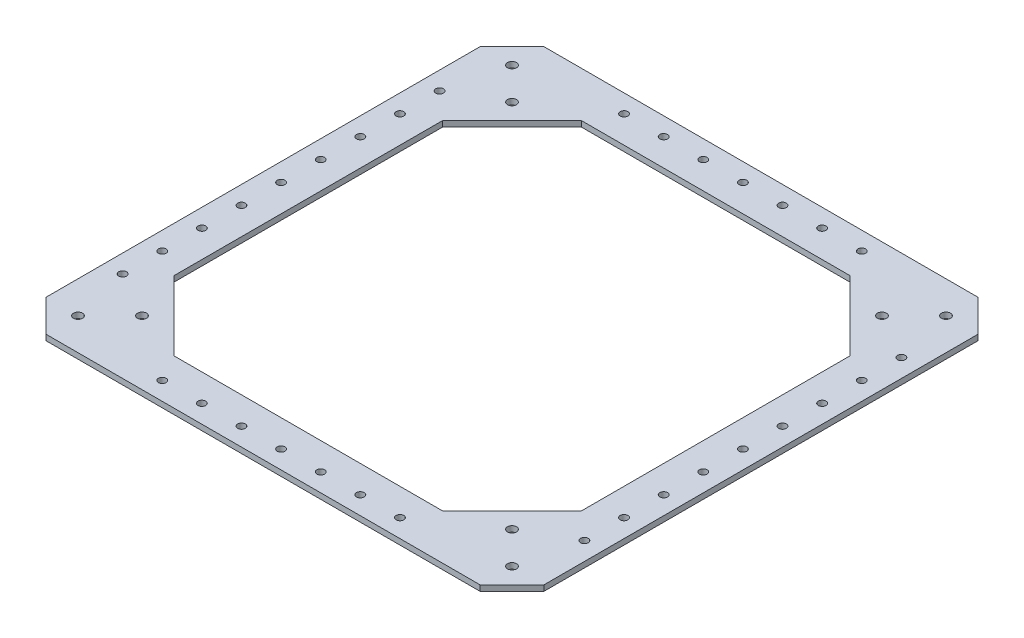
from build123d import *

# Parameters (mm, degrees)
BOSS_EXTRUDE1_DEPTH = 3.175
CUT_EXTRUDE4_DEPTH  = 235.179100055
SKETCH5_R           = 2.54
CUT_EXTRUDE3_DEPTH  = 235.179100055
SKETCH4_R           = 2.159
CUT_EXTRUDE2_DEPTH  = 235.179100055


with BuildPart() as part:
    # Sketch1 → Boss-Extrude1 (new body)
    with BuildSketch(Plane(origin=(0, 0, 0), x_dir=(1, 0, 0), z_dir=(0, 1, 0))):
        Polygon((-139.7, 73.520142619), (-121.739487758, 91.480654861), (121.739487758, 91.480654861), (139.7, 73.520142619), (139.7, -169.958832897), (121.739487758, -187.919345139), (-121.739487758, -187.919345139), (-139.7, -169.958832897), align=None)
    extrude(amount=BOSS_EXTRUDE1_DEPTH)

    # Sketch2 → Cut-Extrude4 (cut, through all)
    with BuildSketch(Plane(origin=(0, 3.175, 0), x_dir=(1, 0, 0), z_dir=(0, 1, 0))):
        Polygon((-103.778975516, 37.599118134), (-114.3, 27.07809365), (-114.3, -123.516783928), (-103.778975516, -134.037808413), (-85.818463274, -151.998320655), (-75.297438789, -162.519345139), (75.297438789, -162.519345139), (85.818463274, -151.998320655), (103.778975516, -134.037808413), (114.3, -123.516783928), (114.3, 27.07809365), (103.778975516, 37.599118134), (85.818463274, 55.559630377), (75.297438789, 66.080654861), (-75.297438789, 66.080654861), (-85.818463274, 55.559630377), align=None)
    extrude(amount=-CUT_EXTRUDE4_DEPTH, mode=Mode.SUBTRACT)

    # Sketch5 → Cut-Extrude3 (cut, through all)
    with BuildSketch(Plane(origin=(0, 3.175, 0), x_dir=(1, 0, 0), z_dir=(0, 1, 0))):
        with Locations((-121.739487758, 73.520142619)):
            Circle(SKETCH5_R)
        with Locations((-103.778975516, 55.559630377)):
            Circle(SKETCH5_R)
        with Locations((103.778975516, 55.559630377)):
            Circle(SKETCH5_R)
        with Locations((121.739487758, 73.520142619)):
            Circle(SKETCH5_R)
        with Locations((121.739487758, -169.958832897)):
            Circle(SKETCH5_R)
        with Locations((103.778975516, -151.998320655)):
            Circle(SKETCH5_R)
        with Locations((-103.778975516, -151.998320655)):
            Circle(SKETCH5_R)
        with Locations((-121.739487758, -169.958832897)):
            Circle(SKETCH5_R)
    extrude(amount=-CUT_EXTRUDE3_DEPTH, mode=Mode.SUBTRACT)

    # Sketch4 → Cut-Extrude2 (cut, through all)
    with BuildSketch(Plane(origin=(0, 3.175, 0), x_dir=(1, 0, 0), z_dir=(0, 1, 0))):
        with Locations((0, 81.320654861)):
            Circle(SKETCH4_R)
        with Locations((-44.45, 81.320654861)):
            Circle(SKETCH4_R)
        with Locations((44.45, 81.320654861)):
            Circle(SKETCH4_R)
        with Locations((-22.225, 81.320654861)):
            Circle(SKETCH4_R)
        with Locations((22.225, 81.320654861)):
            Circle(SKETCH4_R)
        with Locations((-129.54, -48.219345139)):
            Circle(SKETCH4_R)
        with Locations((-129.54, -25.994345139)):
            Circle(SKETCH4_R)
        with Locations((-129.54, -3.769345139)):
            Circle(SKETCH4_R)
        with Locations((129.54, -48.219345139)):
            Circle(SKETCH4_R)
        with Locations((129.54, -25.994345139)):
            Circle(SKETCH4_R)
        with Locations((129.54, -3.769345139)):
            Circle(SKETCH4_R)
        with Locations((129.54, -92.669345139)):
            Circle(SKETCH4_R)
        with Locations((129.54, -70.444345139)):
            Circle(SKETCH4_R)
        with Locations((-129.54, -92.669345139)):
            Circle(SKETCH4_R)
        with Locations((-129.54, -70.444345139)):
            Circle(SKETCH4_R)
        with Locations((22.225, -177.759345139)):
            Circle(SKETCH4_R)
        with Locations((-22.225, -177.759345139)):
            Circle(SKETCH4_R)
        with Locations((44.45, -177.759345139)):
            Circle(SKETCH4_R)
        with Locations((-44.45, -177.759345139)):
            Circle(SKETCH4_R)
        with Locations((0, -177.759345139)):
            Circle(SKETCH4_R)
        with Locations((-66.675, 81.320654861)):
            Circle(SKETCH4_R)
        with Locations((66.675, 81.320654861)):
            Circle(SKETCH4_R)
        with Locations((-129.54, 18.455654861)):
            Circle(SKETCH4_R)
        with Locations((129.54, 18.455654861)):
            Circle(SKETCH4_R)
        with Locations((129.54, -114.894345139)):
            Circle(SKETCH4_R)
        with Locations((66.675, -177.759345139)):
            Circle(SKETCH4_R)
        with Locations((-66.675, -177.759345139)):
            Circle(SKETCH4_R)
        with Locations((-129.54, -114.894345139)):
            Circle(SKETCH4_R)
        with Locations((-129.54, -137.119345139)):
            Circle(SKETCH4_R)
        with Locations((-129.54, 40.680654861)):
            Circle(SKETCH4_R)
        with Locations((129.54, 40.680654861)):
            Circle(SKETCH4_R)
        with Locations((129.54, -137.119345139)):
            Circle(SKETCH4_R)
    extrude(amount=-CUT_EXTRUDE2_DEPTH, mode=Mode.SUBTRACT)


solid = part.part
